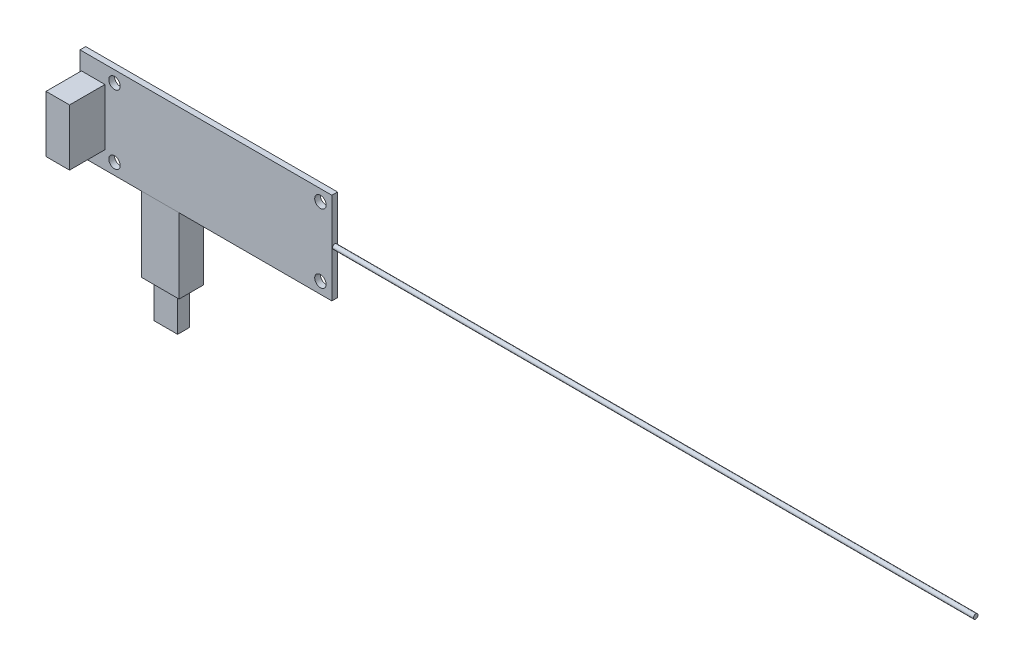
from build123d import *

# Parameters (mm, degrees)
SKETCH1_W                             = 69.85
SKETCH1_H                             = 25.4
EXTRUDE1_DEPTH                        = 1.5748
F_1_8_0_125_DIAMETER_HOLE1_AT_2_COUNT = 2
F_1_8_0_125_DIAMETER_HOLE1_AT_2_PITCH = 57.13222
SKETCH4_R                             = 0.635
BOSS_EXTRUDE1_DEPTH                   = 177.8
SKETCH5_W                             = 8.128
SKETCH5_H                             = 8.7376
USB_CONNECTOR_DEPTH                   = 4.1402
SKETCH6_W                             = 10.40639215
SKETCH6_H                             = 6.781860105
CHARGER_DEPTH                         = 20.828
SKETCH7_W                             = 6.585703948
SKETCH7_H                             = 3.257259008
BOSS_EXTRUDE2_DEPTH                   = 10.16
SKETCH8_W                             = 6.5278
SKETCH8_H                             = 15.6718
BOSS_EXTRUDE3_DEPTH                   = 9.8298


with BuildPart() as part:
    # Sketch1 → Extrude1 (new body)
    with BuildSketch(Plane.XY):
        Rectangle(SKETCH1_W, SKETCH1_H)
    extrude(amount=EXTRUDE1_DEPTH)

    # Sketch3 → 1/8 (0.125) Diameter Hole1 (revolve, cut)
    with BuildSketch(Plane(origin=(-25.38222, 9.525, 1.5748), x_dir=(0, -1, 0), z_dir=(1, 0, 0))):
        Polygon((0, 0), (0, 16.955866233), (1.5875, 16.002), (1.5875, 0), align=None)
    f_1_8_0_125_diameter_hole1 = revolve(axis=Axis((-25.38222, 9.525, 7.9248), (0, 0, -1)), mode=Mode.SUBTRACT)

    # 1/8 (0.125) Diameter Hole1 at 2: 1/8 (0.125) Diameter Hole1 ×2
    with Locations(*[(i * F_1_8_0_125_DIAMETER_HOLE1_AT_2_PITCH, 0, 0) for i in range(1, F_1_8_0_125_DIAMETER_HOLE1_AT_2_COUNT)]):
        add(f_1_8_0_125_diameter_hole1, mode=Mode.SUBTRACT)

    # Mirror1: 1/8 (0.125) Diameter Hole1 across plane
    add(f_1_8_0_125_diameter_hole1.mirror(Plane.ZX), mode=Mode.SUBTRACT)

    # Mirror1 copy 1 sketch → Mirror1 copy 1 (revolve, cut)
    with BuildSketch(Plane(origin=(31.75, -9.525, 1.5748), x_dir=(0, 1, 0), z_dir=(1, 0, 0))):
        Polygon((0, 0), (0, -16.955866233), (1.5875, -16.002), (1.5875, 0), align=None)
    revolve(axis=Axis((31.75, -9.525, 7.9248), (0, 0, 1)), mode=Mode.SUBTRACT)

    # Sketch4 → Boss-Extrude1 (add)
    with BuildSketch(Plane(origin=(34.925, 0, 0), x_dir=(0, 0, -1), z_dir=(1, 0, 0))):
        with Locations((-0.772028936, 0)):
            Circle(SKETCH4_R)
    extrude(amount=BOSS_EXTRUDE1_DEPTH)

    # Sketch5 → USB Connector (add)
    with BuildSketch(Plane(origin=(0, 0, 0), x_dir=(-1, 0, 0), z_dir=(0, 0, -1))):
        with Locations((13.072066229, -8.3312)):
            Rectangle(SKETCH5_W, SKETCH5_H)
    extrude(amount=USB_CONNECTOR_DEPTH)

    # Sketch6 → Charger (add)
    with BuildSketch(Plane.XZ.offset(12.7)):
        with Locations((-12.751236003, -1.907476131)):
            Rectangle(SKETCH6_W, SKETCH6_H)
    extrude(amount=CHARGER_DEPTH)

    # Sketch7 → Boss-Extrude2 (add)
    with BuildSketch(Plane.XZ.offset(33.528)):
        with Locations((-12.72298233, -1.628596112)):
            Rectangle(SKETCH7_W, SKETCH7_H)
    extrude(amount=BOSS_EXTRUDE2_DEPTH)

    # Sketch8 → Boss-Extrude3 (add)
    with BuildSketch(Plane.XY.offset(1.5748)):
        with Locations((-31.2801, 0)):
            Rectangle(SKETCH8_W, SKETCH8_H)
    extrude(amount=BOSS_EXTRUDE3_DEPTH)


solid = part.part
